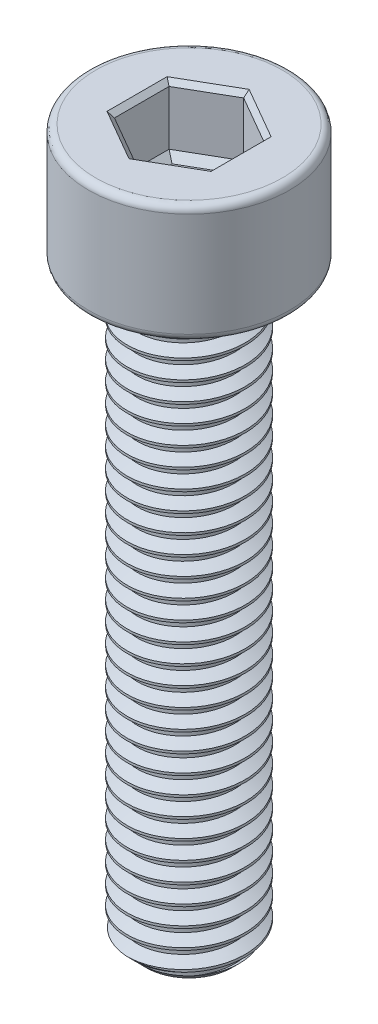
from build123d import *

# Parameters (mm, degrees)
SKETCH1_R           = 2.5
BOSS_EXTRUDE1_DEPTH = 25
THREAD1_PITCH       = 0.8
SKETCH5_R           = 4.25
BOSS_EXTRUDE2_DEPTH = 5
FILLET1_R           = 0.3
CUT_EXTRUDE1_DEPTH  = 2.5
CHAMFER1_SIZE       = 0.2
CUT_EXTRUDE2_DEPTH  = 0.3
CUT_EXTRUDE2_DRAFT  = -45


with BuildPart() as part:
    # Sketch1 → Boss-Extrude1 (new body)
    with BuildSketch(Plane(origin=(0, 0, 0), x_dir=(1, 0, 0), z_dir=(0, 1, 0))):
        with Locations(Location((0, 0, 0), (0, 0, 270))):
            Circle(SKETCH1_R)
    extrude(amount=BOSS_EXTRUDE1_DEPTH)

    # Thread1: arcs per turn and ends read off the stored shape
    # Thread1: the profile of Thread Profile1 profile screwed along a right-hand helix through 32.5 turns, 8 arcs to a turn; built about Z, then put on its axis
    thread1_z = Axis((0, 0, 0), (0, 0, 1))
    thread1_corners = [(2.5003, 0, -0.000173205), (2.5003, 0, 0.700173203), (2.0669873, 0, 0.449999999), (2.0669873, 0, 0.249999999)]
    with BuildLine(mode=Mode.PRIVATE) as thread1_profile:
        Line(thread1_corners[0], thread1_corners[1])
        Line(thread1_corners[1], thread1_corners[2])
        Line(thread1_corners[2], thread1_corners[3])
        Line(thread1_corners[3], thread1_corners[0])
    thread1_cap = Face(thread1_profile.wire())
    thread1_turn_angles = [0, 22.5, 45, 67.5, 90, 112.5, 135, 157.5, 180, 202.5, 225, 247.5, 270, 292.5, 315, 337.5, 360]
    thread1_turn_weights = [1, 0.9238795325112867, 1, 0.9238795325112867, 1, 0.9238795325112867, 1, 0.9238795325112867, 1, 0.9238795325112867, 1, 0.9238795325112867, 1, 0.9238795325112867, 1, 0.9238795325112867, 1]
    thread1_turn_rails = [Edge.make_bspline([Vector(p[0], p[1], 0).rotate(thread1_z, thread1_turn_angles[k]) / thread1_turn_weights[k] + Vector(0, 0, p[2] + THREAD1_PITCH * thread1_turn_angles[k] / 360) for k in range(17)], [0, 0, 0, 1, 1, 2, 2, 3, 3, 4, 4, 5, 5, 6, 6, 7, 7, 8, 8, 8], 2, thread1_turn_weights) for p in thread1_corners]
    thread1_turn_sides = [Face.make_surface_from_curves(thread1_turn_rails[p[0]], thread1_turn_rails[p[1]]) for p in [(0, 1), (1, 2), (2, 3), (3, 0)]]
    thread1_last_angles = [11520, 11542.5, 11565, 11587.5, 11610, 11632.5, 11655, 11677.5, 11700]
    thread1_last_weights = [1, 0.9238795325112867, 1, 0.9238795325112867, 1, 0.9238795325112867, 1, 0.9238795325112806, 1]
    thread1_last_rails = [Edge.make_bspline([Vector(p[0], p[1], 0).rotate(thread1_z, thread1_last_angles[k]) / thread1_last_weights[k] + Vector(0, 0, p[2] + THREAD1_PITCH * thread1_last_angles[k] / 360) for k in range(9)], [0, 0, 0, 1, 1, 2, 2, 3, 3, 4, 4, 4], 2, thread1_last_weights) for p in thread1_corners]
    thread1_last_sides = [Face.make_surface_from_curves(thread1_last_rails[p[0]], thread1_last_rails[p[1]]) for p in [(0, 1), (1, 2), (2, 3), (3, 0)]]
    thread1 = Plane(origin=(0, 26, 0), x_dir=(-1, 0, 0), z_dir=(0, -1, 0)) * Solid(Shell([*[p.moved(Location((0, 0, THREAD1_PITCH * i))) for i in range(32) for p in thread1_turn_sides], *thread1_last_sides, thread1_cap, thread1_cap.rotate(thread1_z, 11700).moved(Location((0, 0, THREAD1_PITCH * 11700 / 360)))]))
    add(thread1, mode=Mode.SUBTRACT)

    # Sketch5 → Boss-Extrude2 (add)
    with BuildSketch(Plane(origin=(0, 25, 0), x_dir=(1, 0, 0), z_dir=(0, 1, 0))):
        with Locations(Location((0, 0, 0), (0, 0, 270))):
            Circle(SKETCH5_R)
    extrude(amount=BOSS_EXTRUDE2_DEPTH)

    # Fillet1
    fillet1_edges = [part.edges().sort_by_distance(p)[0] for p in [
        (0, 25, -4.25),
        (0, 30, -4.25),
    ]]
    fillet(fillet1_edges, radius=FILLET1_R)

    # Sketch6 → Cut-Revolve1 (revolve, cut)
    with BuildSketch(Plane.XY, mode=Mode.PRIVATE) as cut_revolve1_sk:
        Polygon((2.51, 0), (2.51, 0.7), (1.81, 0), align=None)
    revolve(cut_revolve1_sk.sketch.rotate(Axis((0, 0, 0), (0, 1, 0)), 265.327167181), axis=Axis((0, 0, 0), (0, 1, 0)), mode=Mode.SUBTRACT)

    # Sketch7 → Cut-Extrude1 (cut)
    with BuildSketch(Plane(origin=(0, 30, 0), x_dir=(1, 0, 0), z_dir=(0, 1, 0))):
        Polygon((0, 2.309401077), (-2, 1.154700538), (-2, -1.154700538), (0, -2.309401077), (2, -1.154700538), (2, 1.154700538), align=None)
    extrude(amount=-CUT_EXTRUDE1_DEPTH, mode=Mode.SUBTRACT)

    # Chamfer1
    chamfer1_edges = [part.edges().sort_by_distance(p)[0] for p in [
        (1, 30, -1.732050808),
        (-1, 30, -1.732050808),
        (-2, 30, 0),
        (-1, 30, 1.732050808),
        (1, 30, 1.732050808),
        (2, 30, 0),
    ]]
    chamfer(chamfer1_edges, length=CHAMFER1_SIZE)


with BuildPart() as cut_extrude2_tool:
    # Sketch8 → Cut-Extrude2 (with draft: the straight prism first)
    with BuildSketch(Plane(origin=(0, 27.5, 0), x_dir=(1, 0, 0), z_dir=(0, 1, 0))):
        Polygon((0, 2.309401077), (-2, 1.154700538), (-2, -1.154700538), (0, -2.309401077), (2, -1.154700538), (2, 1.154700538), align=None)
    extrude(amount=-CUT_EXTRUDE2_DEPTH)
    # Cut-Extrude2: the draft: its side faces are tilted about the plane it starts from
    cut_extrude2_sides = [cut_extrude2_tool.faces().sort_by_distance(p)[0] for p in [
        (-1, 27.35, -1.732050808),
        (-2, 27.35, 0),
        (-1, 27.35, 1.732050808),
        (1, 27.35, 1.732050808),
        (2, 27.35, 0),
        (1, 27.35, -1.732050808),
    ]]
    draft(cut_extrude2_sides, Plane(origin=(0, 27.5, 0), x_dir=(1, 0, 0), z_dir=(0, 1, 0)), CUT_EXTRUDE2_DRAFT)


with BuildPart() as part_1:
    add(part.part)

    # Cut-Extrude2: cut by cut_extrude2_tool
    add(cut_extrude2_tool.part, mode=Mode.SUBTRACT)


solid = part_1.part
